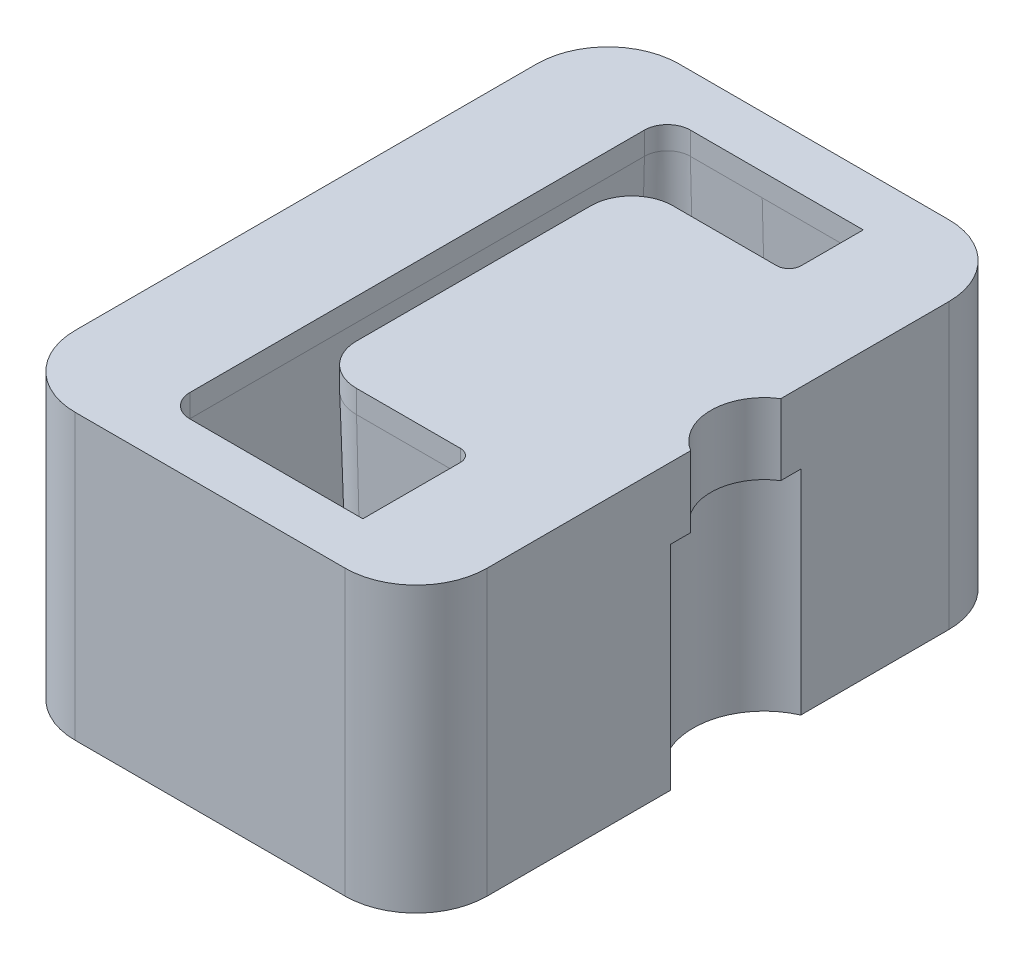
from build123d import *

# Parameters (mm, degrees)
SKETCH1_W                   = 58
SKETCH1_H                   = 85
BOSS_EXTRUDE1_DEPTH         = 40
FILLET1_R                   = 10
CUT_EXTRUDE1_REACH          = 67.171
M6_TAPPED_HOLE1_D           = 5
M6_TAPPED_HOLE1_DEPTH       = 17
M6_TAPPED_HOLE1_CSINK_D     = 6.05
M6_TAPPED_HOLE1_CSINK_ANGLE = 90
M6_TAPPED_HOLE1_TIP         = 1.502151548
SKETCH9_R                   = 7.5
CUT_EXTRUDE2_DEPTH          = 333.145792236
SKETCH10_R                  = 10
CUT_EXTRUDE3_DEPTH          = 30


with BuildPart() as part:
    # Sketch1 → Boss-Extrude1 (new body)
    with BuildSketch(Plane(origin=(0, 0, 0), x_dir=(1, 0, 0), z_dir=(0, 1, 0))):
        Rectangle(SKETCH1_W, SKETCH1_H)
    extrude(amount=-BOSS_EXTRUDE1_DEPTH)

    # Fillet1
    fillet1_edges = [part.edges().sort_by_distance(p)[0] for p in [
        (-29, -20, -42.5),
        (29, -20, -42.5),
        (29, -20, 42.5),
        (-29, -20, 42.5),
    ]]
    fillet(fillet1_edges, radius=FILLET1_R)

    # Sketch2 → Cut-Extrude1 (cut, up to next)
    with BuildSketch(Plane(origin=(0, 0, 0), x_dir=(1, 0, 0), z_dir=(0, 1, 0)), mode=Mode.PRIVATE) as cut_extrude1_sk1:
        with BuildLine():
            Line((14.23, 35.23), (-10.12, 35.23))
            ThreePointArc((-10.12, 35.23), (-12.403954903, 34.283954903), (-13.35, 32))
            Line((-13.35, 32), (-13.35, -32))
            ThreePointArc((-13.35, -32), (-12.403954903, -34.283954903), (-10.12, -35.23))
            Line((-10.12, -35.23), (14.23, -35.23))
            Line((14.23, -35.23), (14.23, -21.5))
            ThreePointArc((14.23, -21.5), (13.723294731, -20.276705269), (12.5, -19.77))
            Line((12.5, -19.77), (-2.12, -19.77))
            ThreePointArc((-2.12, -19.77), (-6.200006127, -18.080006127), (-7.89, -14))
            Line((-7.89, -14), (-7.89, 19))
            ThreePointArc((-7.89, 19), (-6.200006127, 23.080006127), (-2.12, 24.77))
            Line((-2.12, 24.77), (12.5, 24.77))
            ThreePointArc((12.5, 24.77), (13.723294731, 25.276705269), (14.23, 26.5))
            Line((14.23, 26.5), (14.23, 35.23))
        make_face()
    cut_extrude1_tool1 = extrude(cut_extrude1_sk1.sketch, amount=-CUT_EXTRUDE1_REACH, mode=Mode.PRIVATE) & part.part
    add(cut_extrude1_tool1.solids().sort_by_distance((-6.735042, 0, -23.615042))[0], mode=Mode.SUBTRACT)

    # Cut-Sweep1: sweep along a path in Sketch5
    with BuildLine(Plane(origin=(0, 0, 0), x_dir=(1, 0, 0), z_dir=(0, 1, 0))) as cut_sweep1_path:
        Line((12.5, -19.77), (-2.12, -19.77))
        ThreePointArc((-2.12, -19.77), (-6.200006127, -18.080006127), (-7.89, -14))
        Line((-7.89, -14), (-7.89, 19))
        ThreePointArc((-7.89, 19), (-6.200006127, 23.080006127), (-2.12, 24.77))
        Line((-2.12, 24.77), (12.5, 24.77))
        ThreePointArc((12.5, 24.77), (13.723294731, 25.276705269), (14.23, 26.5))
        Line((14.23, 26.5), (14.23, 35.23))
        Line((14.23, 35.23), (-10.12, 35.23))
        ThreePointArc((-10.12, 35.23), (-12.403954903, 34.283954903), (-13.35, 32))
        Line((-13.35, 32), (-13.35, -32))
        ThreePointArc((-13.35, -32), (-12.403954903, -34.283954903), (-10.12, -35.23))
        Line((-10.12, -35.23), (14.23, -35.23))
        Line((14.23, -35.23), (14.23, -21.5))
        ThreePointArc((14.23, -21.5), (13.723294731, -20.276705269), (12.5, -19.77))
    # Sketch3 → Cut-Sweep1 (sweep, cut)
    with BuildSketch(Plane(origin=(0, 0, 0), x_dir=(0, 0, -1), z_dir=(1, 0, 0))):
        Polygon((35.23, -3.2), (36.193641914, -40), (35.23, -40), align=None)
    sweep(path=cut_sweep1_path.line, transition=Transition.RIGHT, mode=Mode.SUBTRACT)

    # M6 Tapped Hole1
    with Locations(Plane(origin=(0, -40, 0), x_dir=(-1, 0, 0), z_dir=(0, -1, 0))):
        with Locations((-22, 35.5), (22, 35.5), (22, -35.5), (-22, -35.5)):
            CounterSinkHole(M6_TAPPED_HOLE1_D / 2, M6_TAPPED_HOLE1_CSINK_D / 2, depth=M6_TAPPED_HOLE1_DEPTH, counter_sink_angle=M6_TAPPED_HOLE1_CSINK_ANGLE)
            with Locations((0, 0, -(M6_TAPPED_HOLE1_DEPTH + M6_TAPPED_HOLE1_TIP / 2))):  # 118° drill point
                Cone(0, M6_TAPPED_HOLE1_D / 2, M6_TAPPED_HOLE1_TIP, mode=Mode.SUBTRACT)

    # Sketch9 → Cut-Extrude2 (cut, through all)
    with BuildSketch(Plane(origin=(296.88, 0, 7.73), x_dir=(1, 0, 0), z_dir=(0, 1, 0))):
        with Locations((-263.88, 10.23)):
            Circle(SKETCH9_R)
    extrude(amount=-CUT_EXTRUDE2_DEPTH, mode=Mode.SUBTRACT)

    # Sketch10 → Cut-Extrude3 (cut)
    with BuildSketch(Plane(origin=(296.88, -40, 7.73), x_dir=(1, 0, 0), z_dir=(0, -1, 0))):
        with Locations((-263.88, -10.23)):
            Circle(SKETCH10_R)
    extrude(amount=-CUT_EXTRUDE3_DEPTH, mode=Mode.SUBTRACT)


solid = part.part
